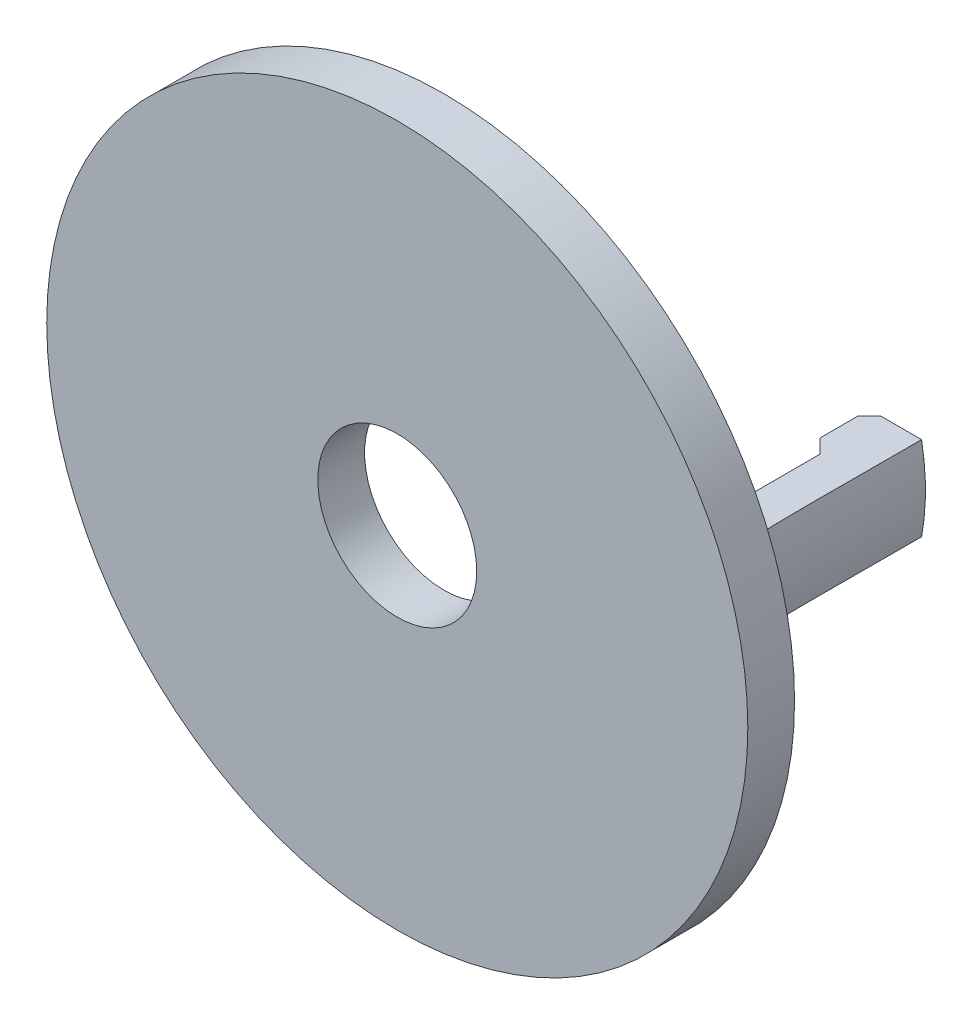
from build123d import *

# Parameters (mm, degrees)
SKETCH4_R           = 37.5
BOSS_EXTRUDE2_DEPTH = 5
SKETCH5_R           = 8.5
CUT_EXTRUDE1_DEPTH  = 54.268189382
BOSS_EXTRUDE3_DEPTH = 4.5
SKETCH1_R           = 37.5
CUT_EXTRUDE2_DEPTH  = 60.285327021


with BuildPart() as part:
    # Sketch4 → Boss-Extrude2 (new body)
    with BuildSketch(Plane.XY):
        Circle(SKETCH4_R)
    extrude(amount=BOSS_EXTRUDE2_DEPTH)

    # Sketch5 → Cut-Extrude1 (cut, through all)
    with BuildSketch(Plane.XY.offset(5)):
        Circle(SKETCH5_R)
    extrude(amount=-CUT_EXTRUDE1_DEPTH, mode=Mode.SUBTRACT)

    # Sketch6 → Boss-Extrude3 (add, symmetric)
    with BuildSketch(Plane(origin=(0, 0, 0), x_dir=(1, 0, 0), z_dir=(0, 1, 0))):
        Polygon((20.5, 2.792893219), (17.707106781, 0), (26.5, 0), (26.5, 26.5), (20.207106781, 26.5), (19, 25.292893219), (19, 21.207106781), (20.5, 19.707106781), align=None)
    boss_extrude3 = extrude(amount=BOSS_EXTRUDE3_DEPTH, both=True)

    # Sketch1 → Cut-Extrude2 (cut, through all)
    with BuildSketch(Plane.XY):
        Circle(SKETCH1_R)
        with BuildLine():
            ThreePointArc((-1, 26.481125354), (18.381376445, 19.088609169), (26.5, 0))
            ThreePointArc((26.5, 0), (18.381376445, -19.088609169), (-1, -26.481125354))
            ThreePointArc((-1, -26.481125354), (-28.5, 0), (-1, 26.481125354))
        make_face(mode=Mode.SUBTRACT)
    cut_extrude2 = extrude(amount=-CUT_EXTRUDE2_DEPTH, mode=Mode.SUBTRACT)

    # Sketch6<4> → Cut-Revolve1 (revolve, cut)
    with BuildSketch(Plane(origin=(0, 0, 0), x_dir=(1, 0, 0), z_dir=(0, 1, 0))):
        with BuildLine():
            add(Edge.make_bspline(
                [(25, 26.5), (25, 22.47818992), (24.990050178, 20.55628723), (25.01194908, 14.930475398), (24.774871471, 4.983935506), (26.5, 0)],
                knots=[0, 0, 0, 0, 0.44660472, 0.54660472, 1, 1, 1, 1], degree=3))
            Line((26.5, 0), (26.5, 26.5))
            Line((26.5, 26.5), (25, 26.5))
        make_face()
    cut_revolve1 = revolve(axis=Axis((0, 0, 0), (0, 0, -1)), mode=Mode.SUBTRACT)

    # Mirror1: Boss-Extrude3, Cut-Extrude2, Cut-Revolve1 across plane
    add(boss_extrude3.mirror(Plane(origin=(0, 0, 0), x_dir=(0, 0, 1), z_dir=(1, 0, 0))))
    add(cut_extrude2.mirror(Plane(origin=(0, 0, 0), x_dir=(0, 0, 1), z_dir=(1, 0, 0))), mode=Mode.SUBTRACT)
    add(cut_revolve1.mirror(Plane(origin=(0, 0, 0), x_dir=(0, 0, 1), z_dir=(1, 0, 0))), mode=Mode.SUBTRACT)


solid = part.part
